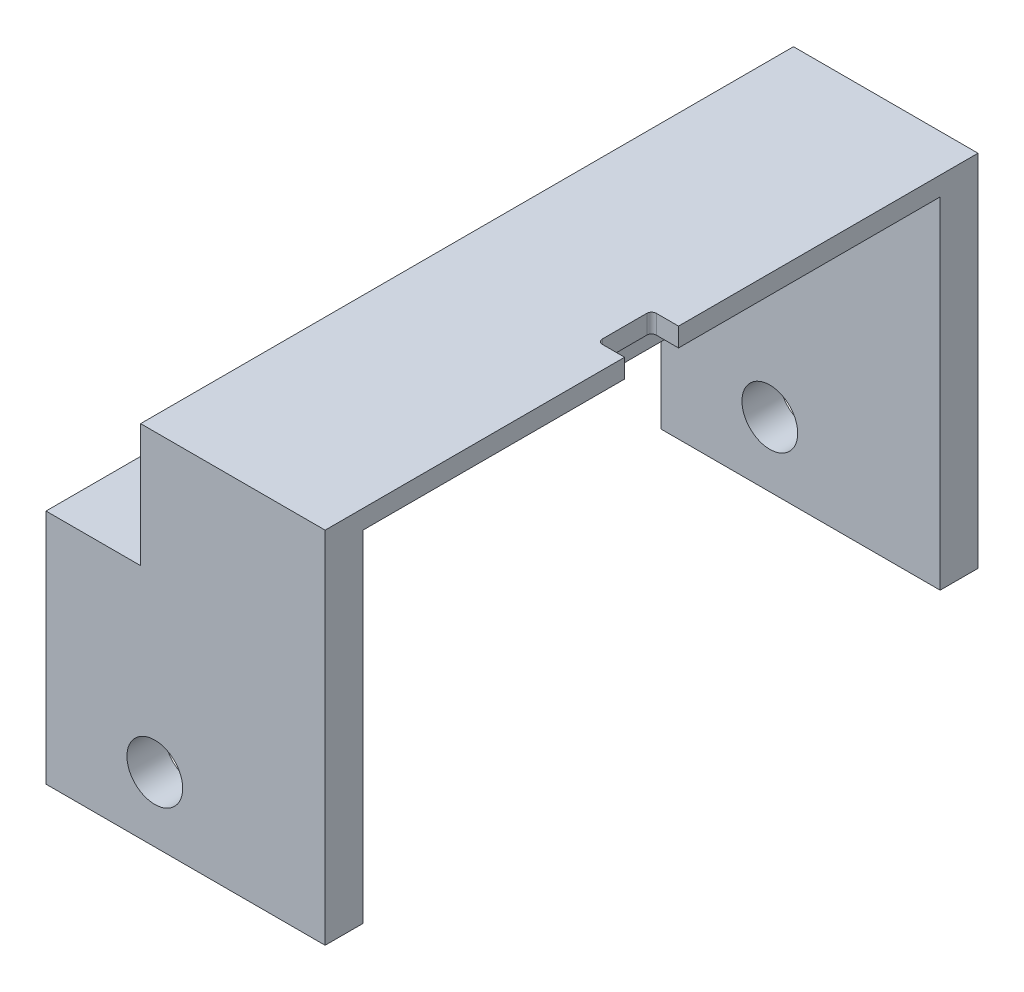
from build123d import *

# Parameters (mm, degrees)
SKETCH1_R                    = 1.1303
BASE_DEPTH                   = 1.5
SKETCH1_4_W                  = 14.75
SKETCH1_4_H                  = 2
BOTTOM_WALLS_DEPTH           = 11
F_4_40_CLOSE_FIT_CLEAR_REACH = 41.1
SKETCH2_R                    = 1.4732
SKETCH1_8_W                  = 2
SKETCH1_8_H                  = 30.5
MIDDLE_WALLS_DEPTH           = 7
ROOF_START                   = 7
ROOF_OUTLINE_W               = 9.75
ROOF_OUTLINE_H               = 34.5
ROOF_DEPTH                   = 1
SKETCH1_5_W                  = 1.425
SKETCH1_5_H                  = 2.85
CUT_EXTRUDE2_DEPTH           = 8
FILLET1_R                    = 0.25


# Read off the part's stored shape, not the designer's step: Roof
with BuildPart() as part:
    # Sketch1 → Base (new body)
    with BuildSketch(Plane(origin=(0, 0, 0), x_dir=(1, 0, 0), z_dir=(0, 1, 0))):
        Polygon((5, -2), (14.75, -2), (14.75, 0), (0, 0), (0, -34.5), (14.75, -34.5), (14.75, -32.5), (5, -32.5), align=None)
        with Locations(Location((2.75, -7.25, 0), (0, 0, 270))):
            Circle(SKETCH1_R, mode=Mode.SUBTRACT)
        with Locations(Location((2.75, -27.25, 0), (0, 0, 270))):
            Circle(SKETCH1_R, mode=Mode.SUBTRACT)
    extrude(amount=BASE_DEPTH)

    # Sketch1<4> → Bottom Walls (add)
    with BuildSketch(Plane(origin=(0, 0, 0), x_dir=(1, 0, 0), z_dir=(0, 1, 0))):
        with Locations((7.375, -1)):
            Rectangle(SKETCH1_4_W, SKETCH1_4_H)
        with Locations((7.375, -33.5)):
            Rectangle(SKETCH1_4_W, SKETCH1_4_H)
    extrude(amount=-BOTTOM_WALLS_DEPTH)

    # 4-40_Close_fit Clear: up to this face of the body (flat: up to its plane)
    f_4_40_close_fit_clear_end = Plane(part.part.faces().sort_by_distance((7.375, -4.75, 0))[0])
    # Sketch2 → 4-40_Close_fit Clear (cut, up to the picked face)
    with BuildSketch(Plane.XY.offset(34.5), mode=Mode.PRIVATE) as f_4_40_close_fit_clear_sk1:
        with Locations((5.75, -7.58)):
            Circle(SKETCH2_R)
    f_4_40_close_fit_clear_tool1 = split(extrude(f_4_40_close_fit_clear_sk1.sketch, amount=-F_4_40_CLOSE_FIT_CLEAR_REACH, mode=Mode.PRIVATE), bisect_by=f_4_40_close_fit_clear_end, keep=Keep.BOTH, mode=Mode.PRIVATE)
    add(f_4_40_close_fit_clear_tool1.solids().sort_by(Axis((5.75, -7.58, 34.5), (0, 0, -1)))[0], mode=Mode.SUBTRACT)

    # Sketch1<8> → Middle Walls (add)
    with BuildSketch(Plane(origin=(0, 0, 0), x_dir=(1, 0, 0), z_dir=(0, 1, 0))):
        Polygon((5, -2), (7, -2), (12.75, -2), (14.75, -2), (14.75, 0), (5, 0), align=None)
        with Locations((6, -17.25)):
            Rectangle(SKETCH1_8_W, SKETCH1_8_H)
        Polygon((12.75, -32.5), (7, -32.5), (5, -32.5), (5, -34.5), (14.75, -34.5), (14.75, -32.5), align=None)
    extrude(amount=MIDDLE_WALLS_DEPTH)

    # Roof outline → Roof (add)
    with BuildSketch(Plane(origin=(0, 0, 0), x_dir=(1, 0, 0), z_dir=(0, 1, 0)).offset(ROOF_START)):
        with Locations((9.875, -17.25)):
            Rectangle(ROOF_OUTLINE_W, ROOF_OUTLINE_H)
    extrude(amount=ROOF_DEPTH)

    # Sketch1<5> → Cut-Extrude2 (cut)
    with BuildSketch(Plane(origin=(0, 0, 0), x_dir=(1, 0, 0), z_dir=(0, 1, 0))):
        with Locations((14.0375, -17.25)):
            Rectangle(SKETCH1_5_W, SKETCH1_5_H)
        with Locations((15.4625, -17.25)):
            Rectangle(SKETCH1_5_W, SKETCH1_5_H)
    extrude(amount=CUT_EXTRUDE2_DEPTH, mode=Mode.SUBTRACT)

    # Fillet1
    fillet1_edges = [part.edges().sort_by_distance(p)[0] for p in [
        (13.325, 7.5, 15.825),
        (13.325, 7.5, 18.675),
    ]]
    fillet(fillet1_edges, radius=FILLET1_R)


solid = part.part
